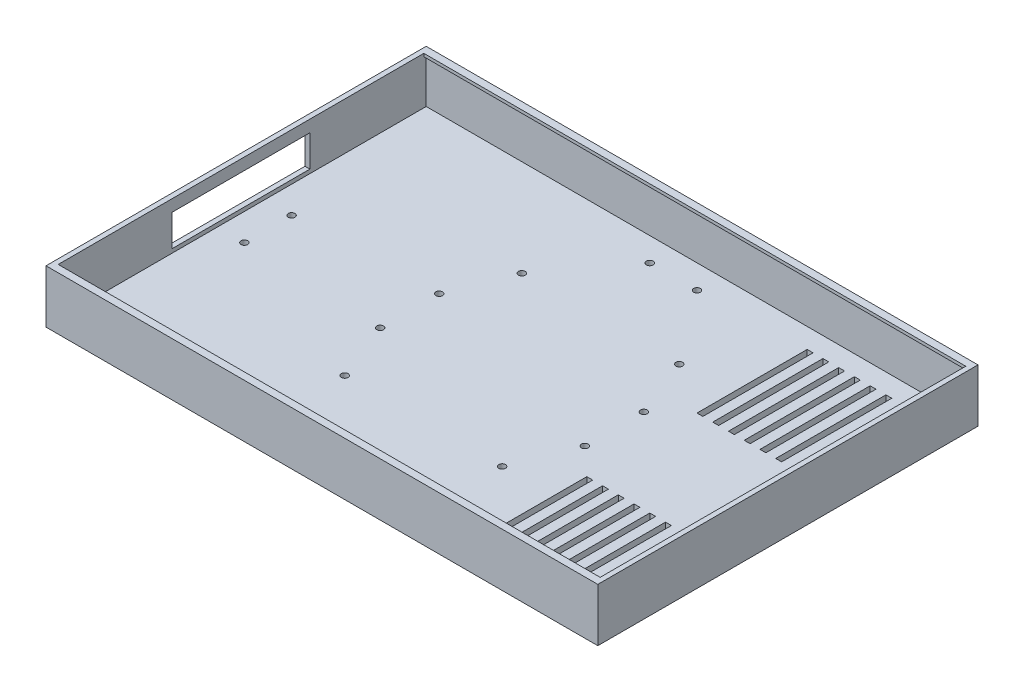
from build123d import *

# Parameters (mm, degrees)
SKETCH1_W                     = 280.4
SKETCH1_H                     = 193.2
SHELL_BLOCK_DEPTH             = 27
SKETCH2_W                     = 275.4
SKETCH2_H                     = 185.8
FRONT_OPENING_DEPTH           = 1.5
SKETCH3_W                     = 275.4
SKETCH3_H                     = 188.2
DISPLAY_POCKET_DEPTH          = 22.5
SKETCH4_W                     = 3
SKETCH4_H                     = 56
VENT_SLOTS_DEPTH              = 4
SKETCH5_W                     = 70
SKETCH5_H                     = 16
CABLE_EXIT_X_SHORT_SIDE_DEPTH = 141.2
SKETCH6_R                     = 1.7
BOLT_HOLES_DEPTH              = 4


with BuildPart() as part:
    # Sketch1 → Shell Block (new body)
    with BuildSketch(Plane(origin=(0, 0, 0), x_dir=(1, 0, 0), z_dir=(0, 1, 0))):
        Rectangle(SKETCH1_W, SKETCH1_H)
    extrude(amount=SHELL_BLOCK_DEPTH)

    # Sketch2 → Front Opening (cut)
    with BuildSketch(Plane(origin=(0, 27, 0), x_dir=(1, 0, 0), z_dir=(0, 1, 0))):
        Rectangle(SKETCH2_W, SKETCH2_H)
    extrude(amount=-FRONT_OPENING_DEPTH, mode=Mode.SUBTRACT)

    # Sketch3 → Display Pocket (cut)
    with BuildSketch(Plane(origin=(0, 25.5, 0), x_dir=(1, 0, 0), z_dir=(0, 1, 0))):
        Rectangle(SKETCH3_W, SKETCH3_H)
    extrude(amount=-DISPLAY_POCKET_DEPTH, mode=Mode.SUBTRACT)

    # Sketch4 → Vent Slots (cut)
    with BuildSketch(Plane(origin=(0, 3, 0), x_dir=(1, 0, 0), z_dir=(0, 1, 0))):
        with Locations((67.5, 56)):
            Rectangle(SKETCH4_W, SKETCH4_H)
        with Locations((67.5, -56)):
            Rectangle(SKETCH4_W, SKETCH4_H)
        with Locations((75.5, 56)):
            Rectangle(SKETCH4_W, SKETCH4_H)
        with Locations((75.5, -56)):
            Rectangle(SKETCH4_W, SKETCH4_H)
        with Locations((83.5, 56)):
            Rectangle(SKETCH4_W, SKETCH4_H)
        with Locations((83.5, -56)):
            Rectangle(SKETCH4_W, SKETCH4_H)
        with Locations((91.5, 56)):
            Rectangle(SKETCH4_W, SKETCH4_H)
        with Locations((91.5, -56)):
            Rectangle(SKETCH4_W, SKETCH4_H)
        with Locations((99.5, 56)):
            Rectangle(SKETCH4_W, SKETCH4_H)
        with Locations((99.5, -56)):
            Rectangle(SKETCH4_W, SKETCH4_H)
        with Locations((107.5, 56)):
            Rectangle(SKETCH4_W, SKETCH4_H)
        with Locations((107.5, -56)):
            Rectangle(SKETCH4_W, SKETCH4_H)
        with Locations((115.5, 56)):
            Rectangle(SKETCH4_W, SKETCH4_H)
        with Locations((115.5, -56)):
            Rectangle(SKETCH4_W, SKETCH4_H)
        with Locations((123.5, 56)):
            Rectangle(SKETCH4_W, SKETCH4_H)
        with Locations((123.5, -56)):
            Rectangle(SKETCH4_W, SKETCH4_H)
    extrude(amount=-VENT_SLOTS_DEPTH, mode=Mode.SUBTRACT)

    # Sketch5 → Cable Exit (+X short side) (cut)
    with BuildSketch(Plane(origin=(0, 0, 0), x_dir=(0, 0, -1), z_dir=(1, 0, 0))):
        with Locations((0, 13)):
            Rectangle(SKETCH5_W, SKETCH5_H)
    extrude(amount=-CABLE_EXIT_X_SHORT_SIDE_DEPTH, mode=Mode.SUBTRACT)

    # Sketch6 → Bolt Holes (cut)
    with BuildSketch(Plane(origin=(0, 3, 0), x_dir=(1, 0, 0), z_dir=(0, 1, 0))):
        with Locations((-40, -45)):
            Circle(SKETCH6_R)
        with Locations((-40, 45)):
            Circle(SKETCH6_R)
        with Locations((40, -45)):
            Circle(SKETCH6_R)
        with Locations((40, 45)):
            Circle(SKETCH6_R)
        with Locations((-52, -15)):
            Circle(SKETCH6_R)
        with Locations((-52, 15)):
            Circle(SKETCH6_R)
        with Locations((52, -15)):
            Circle(SKETCH6_R)
        with Locations((52, 15)):
            Circle(SKETCH6_R)
        with Locations((-12, -82)):
            Circle(SKETCH6_R)
        with Locations((-12, 82)):
            Circle(SKETCH6_R)
        with Locations((12, -82)):
            Circle(SKETCH6_R)
        with Locations((12, 82)):
            Circle(SKETCH6_R)
        with Locations((-124, -12)):
            Circle(SKETCH6_R)
        with Locations((-124, 12)):
            Circle(SKETCH6_R)
        with Locations((124, -12)):
            Circle(SKETCH6_R)
        with Locations((124, 12)):
            Circle(SKETCH6_R)
    extrude(amount=-BOLT_HOLES_DEPTH, mode=Mode.SUBTRACT)


solid = part.part
